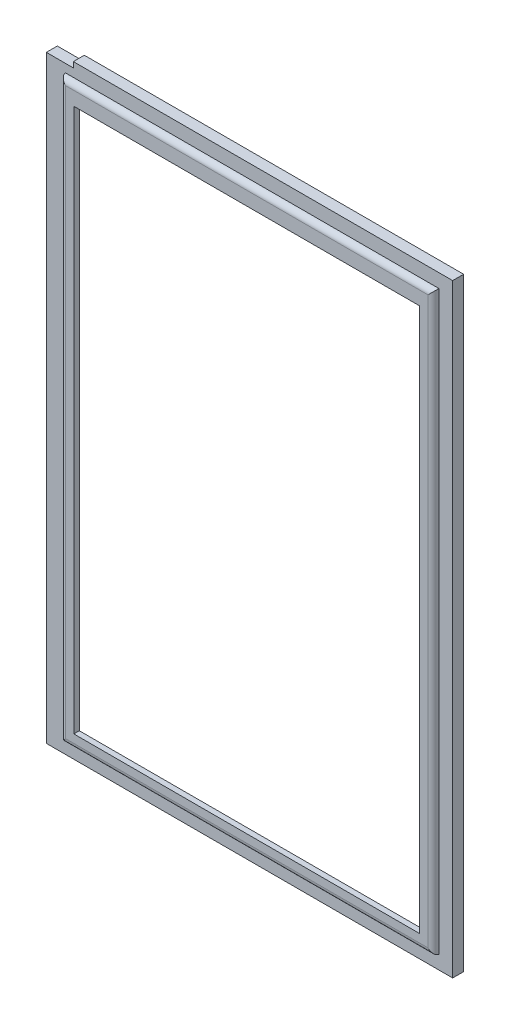
from build123d import *

# Parameters (mm, degrees)
ESBO_O2_W                = 740
ESBO_O2_H                = 1100
ESBO_O2_W_2              = 680
ESBO_O2_H_2              = 1050
RESSALTO_EXTRUS_O1_DEPTH = 20
ESBO_O3_W                = 680
ESBO_O3_H                = 1050
ESBO_O3_W_2              = 630
ESBO_O3_H_2              = 990
RESSALTO_EXTRUS_O2_DEPTH = 10
FILETE1_R                = 10
ESBO_O4_W                = 49.143238
ESBO_O4_H                = 10
CORTE_EXTRUS_O1_DEPTH    = 20


with BuildPart() as part:
    # Esboço2 → Ressalto-extrusão1 (new body)
    with BuildSketch(Plane.XY):
        with Locations((370, -550)):
            Rectangle(ESBO_O2_W, ESBO_O2_H)
        with Locations((375, -550)):
            Rectangle(ESBO_O2_W_2, ESBO_O2_H_2, mode=Mode.SUBTRACT)
    extrude(amount=RESSALTO_EXTRUS_O1_DEPTH)

    # Esboço4 → Corte-extrusão1 (cut)
    with BuildSketch(Plane.XY.offset(20)):
        with Locations((24.571619, -5)):
            Rectangle(ESBO_O4_W, ESBO_O4_H)
    extrude(amount=-CORTE_EXTRUS_O1_DEPTH, mode=Mode.SUBTRACT)


with BuildPart() as body_2:
    # Esboço3 → Ressalto-extrusão2 (new body)
    with BuildSketch(Plane.XY.offset(20)):
        with Locations((375, -550)):
            Rectangle(ESBO_O3_W, ESBO_O3_H)
        with Locations((375, -555)):
            Rectangle(ESBO_O3_W_2, ESBO_O3_H_2, mode=Mode.SUBTRACT)
    extrude(amount=RESSALTO_EXTRUS_O2_DEPTH)

    # Filete1
    filete1_edges = [body_2.edges().sort_by_distance(p)[0] for p in [
        (715, -550, 30),
        (375, -25, 30),
        (35, -550, 30),
        (375, -1075, 30),
    ]]
    fillet(filete1_edges, radius=FILETE1_R - 0.0001)  # a hair under: the kernel refuses the full size


solid = Compound([part.part, body_2.part])
